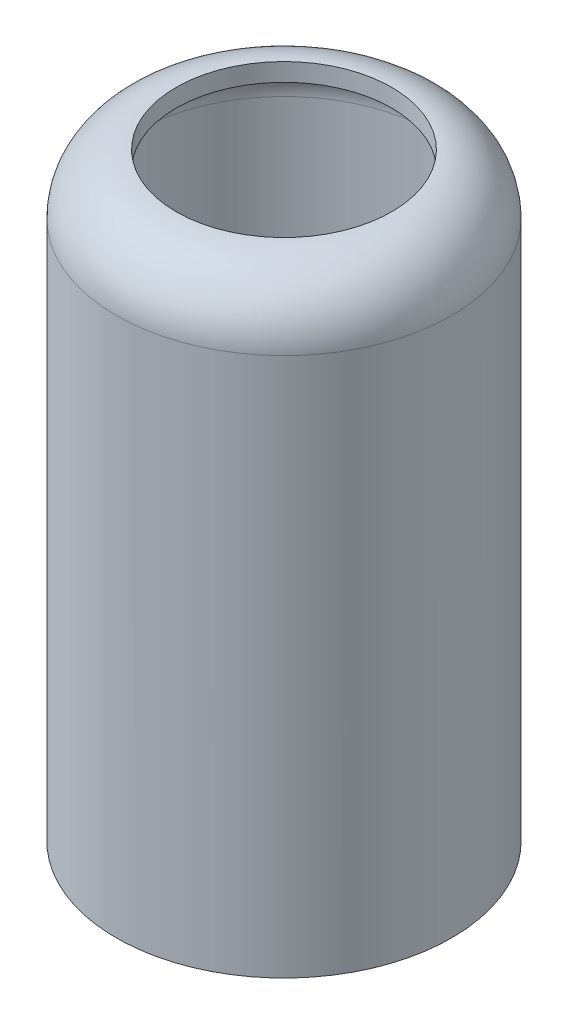
from build123d import *

# Parameters (mm, degrees)
SKETCH1_R           = 28
BOSS_EXTRUDE1_DEPTH = 100
FILLET1_R           = 10


# Read off the part's stored shape, not the designer's step: Shell1
with BuildPart() as part:
    # Sketch1 → Boss-Extrude1 (new body)
    with BuildSketch(Plane(origin=(0, 0, 0), x_dir=(1, 0, 0), z_dir=(0, 1, 0))):
        with Locations(Location((0, 0, 0), (0, 0, 90))):
            Circle(SKETCH1_R)
    extrude(amount=BOSS_EXTRUDE1_DEPTH)

    # Fillet1
    fillet1_edges = [part.edges().sort_by_distance(p)[0] for p in [
        (0, 100, 28),
    ]]
    fillet(fillet1_edges, radius=FILLET1_R)

    # Shell1 outline → Shell1 (revolve, cut)
    with BuildSketch(Plane.XY):
        with BuildLine():
            Line((0, 3), (25, 3))
            Line((25, 3), (25, 90))
            ThreePointArc((25, 90), (22.949747468, 94.949747468), (18, 97))
            Line((18, 97), (18, 100))
            Line((18, 100), (0, 100))
            Line((0, 100), (0, 3))
        make_face()
    revolve(axis=Axis((0, 0, 0), (0, 1, 0)), mode=Mode.SUBTRACT)


solid = part.part
